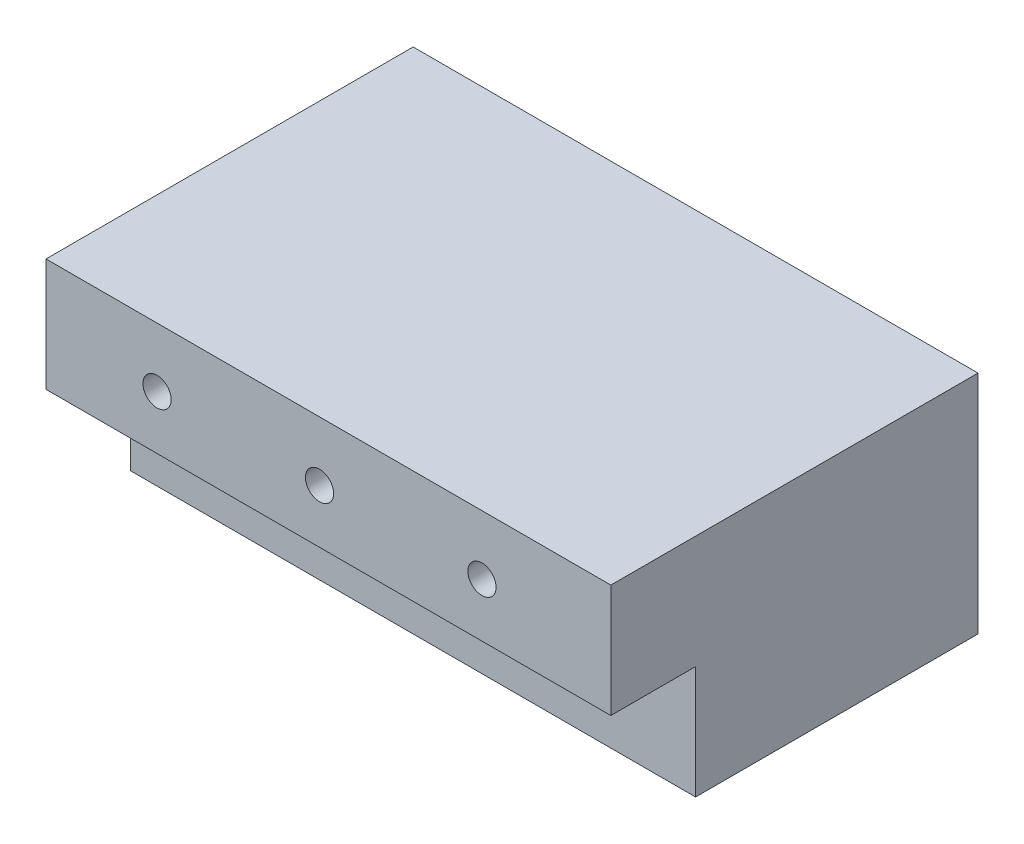
from build123d import *

# Parameters (mm, degrees)
SKETCH_1_W          = 200
SKETCH_1_H          = 40
EXTRUDE_1_DEPTH     = 100
SKETCH_1_3_W        = 200
SKETCH_1_3_H        = 40
EXTRUDE_2_DEPTH     = 130
SKETCH_9_R          = 5
CUT_EXTRUDE_4_DEPTH = 35
CUT_EXTRUDE_4_DRAFT = -1
SKETCH_9_3_R        = 5
CUT_EXTRUDE_5_DEPTH = 25
CUT_EXTRUDE_5_DRAFT = -1
SKETCH_9_4_R        = 5
CUT_EXTRUDE_6_DEPTH = 30
CUT_EXTRUDE_6_DRAFT = -1


with BuildPart() as part:
    # Эскиз1 → Бобышка-Вытянуть1 (new body)
    with BuildSketch(Plane.XY):
        with Locations((100, 20)):
            Rectangle(SKETCH_1_W, SKETCH_1_H)
    extrude(amount=EXTRUDE_1_DEPTH)

    # Эскиз1<3> → Бобышка-Вытянуть2 (add)
    with BuildSketch(Plane.XY):
        with Locations((100, 60)):
            Rectangle(SKETCH_1_3_W, SKETCH_1_3_H)
    extrude(amount=EXTRUDE_2_DEPTH)


with BuildPart() as cut_extrude_4_tool:
    # Эскиз9 → Вырез-Вытянуть4 (with draft: the straight prism first)
    with BuildSketch(Plane(origin=(-3.148281851, 38.970132862, 130), x_dir=(1, 0, 0), z_dir=(0, 0, 1))):
        with Locations((42.471240213, 20)):
            Circle(SKETCH_9_R)
    extrude(amount=-CUT_EXTRUDE_4_DEPTH)
    # Вырез-Вытянуть4: the draft: its side faces are tilted about the plane it starts from
    cut_extrude_4_sides = [cut_extrude_4_tool.faces().sort_by_distance(p)[0] for p in [
        (34.322958362, 58.970132862, 112.5),
    ]]
    draft(cut_extrude_4_sides, Plane(origin=(-3.148281851, 38.970132862, 130), x_dir=(1, 0, 0), z_dir=(0, 0, 1)), CUT_EXTRUDE_4_DRAFT)


with BuildPart() as part_1:
    add(part.part)

    # Вырез-Вытянуть4: cut by cut_extrude_4_tool
    add(cut_extrude_4_tool.part, mode=Mode.SUBTRACT)


with BuildPart() as cut_extrude_5_tool:
    # Эскиз9<3> → Вырез-Вытянуть5 (with draft: the straight prism first)
    with BuildSketch(Plane(origin=(-3.148281851, 38.970132862, 130), x_dir=(1, 0, 0), z_dir=(0, 0, 1))):
        with Locations((157.511612736, 20)):
            Circle(SKETCH_9_3_R)
    extrude(amount=-CUT_EXTRUDE_5_DEPTH)
    # Вырез-Вытянуть5: the draft: its side faces are tilted about the plane it starts from
    cut_extrude_5_sides = [cut_extrude_5_tool.faces().sort_by_distance(p)[0] for p in [
        (149.363330884, 58.970132862, 117.5),
    ]]
    draft(cut_extrude_5_sides, Plane(origin=(-3.148281851, 38.970132862, 130), x_dir=(1, 0, 0), z_dir=(0, 0, 1)), CUT_EXTRUDE_5_DRAFT)


with BuildPart() as part_2:
    add(part_1.part)

    # Вырез-Вытянуть5: cut by cut_extrude_5_tool
    add(cut_extrude_5_tool.part, mode=Mode.SUBTRACT)


with BuildPart() as cut_extrude_6_tool:
    # Эскиз9<4> → Вырез-Вытянуть6 (with draft: the straight prism first)
    with BuildSketch(Plane(origin=(-3.148281851, 38.970132862, 130), x_dir=(1, 0, 0), z_dir=(0, 0, 1))):
        with Locations((100, 20)):
            Circle(SKETCH_9_4_R)
    extrude(amount=-CUT_EXTRUDE_6_DEPTH)
    # Вырез-Вытянуть6: the draft: its side faces are tilted about the plane it starts from
    cut_extrude_6_sides = [cut_extrude_6_tool.faces().sort_by_distance(p)[0] for p in [
        (91.851718149, 58.970132862, 115),
    ]]
    draft(cut_extrude_6_sides, Plane(origin=(-3.148281851, 38.970132862, 130), x_dir=(1, 0, 0), z_dir=(0, 0, 1)), CUT_EXTRUDE_6_DRAFT)


with BuildPart() as part_3:
    add(part_2.part)

    # Вырез-Вытянуть6: cut by cut_extrude_6_tool
    add(cut_extrude_6_tool.part, mode=Mode.SUBTRACT)


solid = part_3.part
